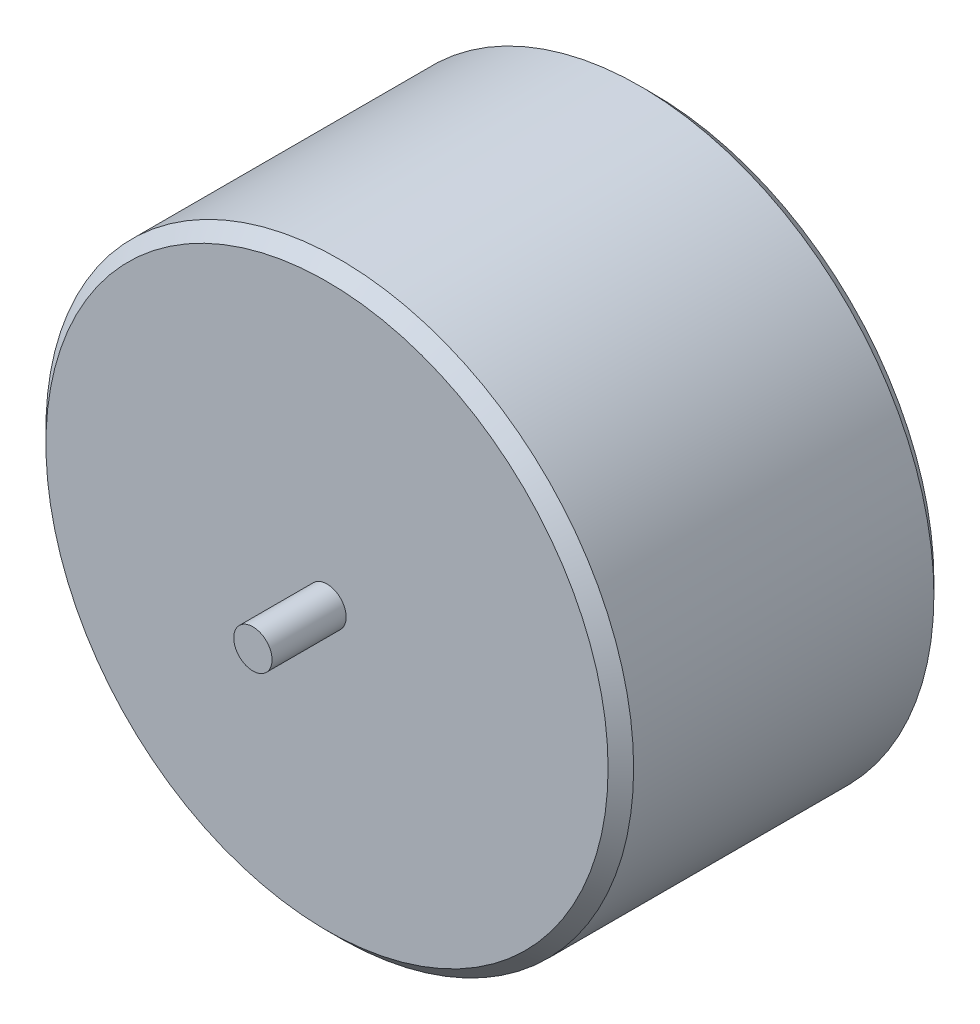
from build123d import *

# Parameters (mm, degrees)
SKETCH1_R           = 23
BOSS_EXTRUDE1_DEPTH = 25.5
SKETCH3_R           = 1.5
BOSS_EXTRUDE4_DEPTH = 5.8
CHAMFER1_SIZE       = 1


with BuildPart() as part:
    # Sketch1 → Boss-Extrude1 (new body)
    with BuildSketch(Plane.XY):
        Circle(SKETCH1_R)
    extrude(amount=BOSS_EXTRUDE1_DEPTH)

    # Sketch3 → Boss-Extrude4 (add)
    with BuildSketch(Plane.XY.offset(25.5)):
        Circle(SKETCH3_R)
    extrude(amount=BOSS_EXTRUDE4_DEPTH)

    # Chamfer1
    chamfer1_edges = [part.edges().sort_by_distance(p)[0] for p in [
        (-23, 0, 0),
        (-23, 0, 25.5),
    ]]
    chamfer(chamfer1_edges, length=CHAMFER1_SIZE)


solid = part.part
